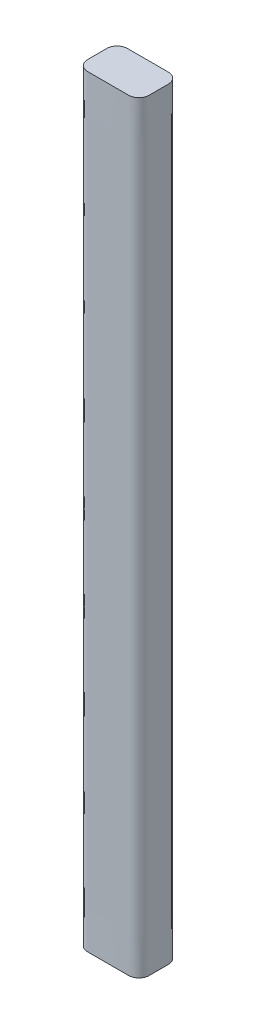
from build123d import *

# Parameters (mm, degrees)
BOSS_EXTRUDE1_DEPTH = 370


# Read off the part's stored shape, not the designer's step: wheelsupbelow.ipt<1>
with BuildPart() as part:
    # Sketch1 → Boss-Extrude1 (new body)
    with BuildSketch(Plane(origin=(0, 96, 0), x_dir=(1, 0, 0), z_dir=(0, 1, 0))):
        with BuildLine():
            add(Edge.make_bspline(
                [(-64.857014863, -4.67794204), (-64.857014863, -6.002927572), (-64.305638376, -7.319354275), (-63.362042701, -8.247229669), (-62.441219754, -9.152711729), (-61.158861894, -9.67794204), (-59.868936504, -9.67794204), (-58.165378118, -9.67794204), (-56.461819732, -9.67794204), (-54.758261346, -9.67794204), (-52.254441385, -9.67794204), (-49.750621424, -9.67794204), (-47.246801463, -9.67794204), (-44.803408666, -9.67794204), (-42.360015868, -9.67794204), (-39.91662307, -9.67794204), (-38.594796738, -9.67794204), (-37.281508829, -9.125247748), (-36.355845794, -8.179396855), (-35.452522701, -7.256373116), (-34.928544711, -5.970950386), (-34.928544711, -4.67794204), (-34.928544711, -3.099581964), (-34.928544711, -1.521221889), (-34.928544711, 0.057138187), (-34.928544711, 1.597406138), (-34.928544711, 3.137674089), (-34.928544711, 4.67794204), (-34.928544711, 6.002927572), (-35.479921198, 7.319354275), (-36.423516873, 8.247229669), (-37.34433982, 9.152711729), (-38.62669768, 9.67794204), (-39.91662307, 9.67794204), (-41.620181456, 9.67794204), (-43.323739842, 9.67794204), (-45.027298228, 9.67794204), (-47.531118189, 9.67794204), (-50.03493815, 9.67794204), (-52.538758111, 9.67794204), (-54.982150909, 9.67794204), (-57.425543706, 9.67794204), (-59.868936504, 9.67794204), (-61.190762836, 9.67794204), (-62.504050746, 9.125247748), (-63.42971378, 8.179396855), (-64.333036873, 7.256373116), (-64.857014863, 5.970950386), (-64.857014863, 4.67794204), (-64.857014863, 3.099581964), (-64.857014863, 1.521221889), (-64.857014863, -0.057138187), (-64.857014863, -1.597406138), (-64.857014863, -3.137674089), (-64.857014863, -4.67794204)],
                knots=[-1, -1, -1, -1, -0.955896391, -0.955896391, -0.955896391, -0.912857178, -0.912857178, -0.912857178, -0.856016827, -0.856016827, -0.856016827, -0.77247522, -0.77247522, -0.77247522, -0.690949805, -0.690949805, -0.690949805, -0.646846196, -0.646846196, -0.646846196, -0.603806983, -0.603806983, -0.603806983, -0.551269522, -0.551269522, -0.551269522, -0.5, -0.5, -0.5, -0.455896391, -0.455896391, -0.455896391, -0.412857178, -0.412857178, -0.412857178, -0.356016827, -0.356016827, -0.356016827, -0.27247522, -0.27247522, -0.27247522, -0.190949805, -0.190949805, -0.190949805, -0.146846196, -0.146846196, -0.146846196, -0.103806983, -0.103806983, -0.103806983, -0.051269522, -0.051269522, -0.051269522, 0, 0, 0, 0], degree=3, weights=[1, 1, 1, 1, 1, 1, 1, 1, 1, 1, 1, 1, 1, 1, 1, 1, 1, 1, 1, 1, 1, 1, 1, 1, 1, 1, 1, 1, 1, 1, 1, 1, 1, 1, 1, 1, 1, 1, 1, 1, 1, 1, 1, 1, 1, 1, 1, 1, 1, 1, 1, 1, 1, 1, 1]))
        make_face()
    extrude(amount=BOSS_EXTRUDE1_DEPTH)


solid = part.part
